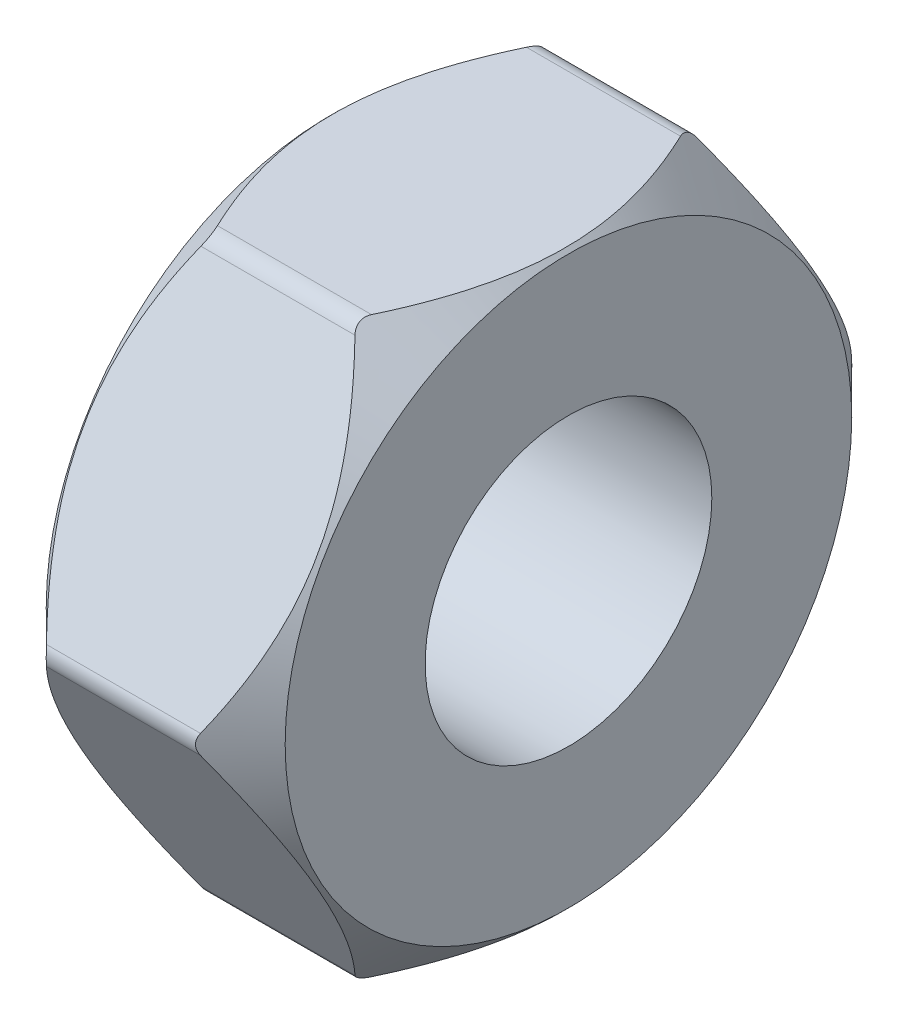
from build123d import *

# Parameters (mm, degrees)
ESQUISSE1_R                           = 15
BOSS_EXTRU_1_DEPTH                    = 25
CONG_1_R                              = 2
CHANFREIN1_SIZE                       = 2
ENL_VEMENT_DE_MATI_RE_BALAYAGE3_PITCH = 4


with BuildPart() as part:
    # Esquisse1 → Boss.-Extru.1 (new body)
    with BuildSketch(Plane(origin=(0, 0, 0), x_dir=(0, 0, -1), z_dir=(1, 0, 0))):
        Polygon((34.641016151, 0), (17.320508076, 30), (-17.320508076, 30), (-34.641016151, 0), (-17.320508076, -30), (17.320508076, -30), align=None)
        Circle(ESQUISSE1_R, mode=Mode.SUBTRACT)
    extrude(amount=BOSS_EXTRU_1_DEPTH)

    # Esquisse2 → Enlèvement de matière-Révolution2 (revolve, cut)
    with BuildSketch(Plane(origin=(0, 0, 0), x_dir=(1, 0, 0), z_dir=(0, 1, 0))):
        Polygon((0, -34.641016151), (0, -29.641016151), (5, -34.641016151), align=None)
        Polygon((25, -34.641016151), (25, -29.641016151), (20, -34.641016151), align=None)
    revolve(axis=Axis((-5.539786703, 0, 0), (1, 0, 0)), mode=Mode.SUBTRACT)

    # Congé1
    # the kernel refuses this fillet: 2 mm, written as the material it takes off along each edge
    with BuildSketch(Plane(origin=(2.113248654, 30, 17.320508076), x_dir=(0, 0, -1), z_dir=(1, 0, 0)), Plane(origin=(2.113248654, -30, 17.320508076), x_dir=(0, 0.8660254037844392, 0.49999999999999933), z_dir=(1, 0, 0)), Plane(origin=(2.113248654, 30, -17.320508076), x_dir=(0, -0.8660254037844392, -0.49999999999999933), z_dir=(1, 0, 0))) as cong_1_piece_1:
        with BuildLine():
            CenterArc((CONG_1_R * 0.57735026919, -CONG_1_R), CONG_1_R, 90, 60)
            Line((-CONG_1_R * 0.288675134595, -CONG_1_R * 0.5), (0, 0))
            Line((0, 0), (CONG_1_R * 0.57735026919, 0))
        make_face()
    extrude(amount=20.773502692, mode=Mode.SUBTRACT)
    with BuildSketch(Plane(origin=(2.113248654, 0, 34.641016151), x_dir=(0, -0.8660254037844395, -0.49999999999999856), z_dir=(1, 0, 0)), Plane(origin=(2.113248654, -30, -17.320508076), x_dir=(0, 0.8660254037844393, -0.49999999999999895), z_dir=(1, 0, 0)), Plane(origin=(2.113248654, 0, -34.641016151), x_dir=(0, 0.8660254037844395, 0.49999999999999856), z_dir=(1, 0, 0))) as cong_1_piece_2:
        with BuildLine():
            CenterArc((CONG_1_R * 0.57735026919, CONG_1_R), CONG_1_R, 210, 60)
            Line((-CONG_1_R * 0.288675134595, CONG_1_R * 0.5), (0, 0))
            Line((0, 0), (CONG_1_R * 0.57735026919, 0))
        make_face()
    extrude(amount=20.773502692, mode=Mode.SUBTRACT)

    # Chanfrein1
    chanfrein1_edges = [part.edges().sort_by_distance(p)[0] for p in [
        (0, 0, 15),
    ]]
    chamfer(chanfrein1_edges, length=CHANFREIN1_SIZE)

    # Enlèvement de matière-Balayage3: arcs per turn and ends read off the stored shape
    # Enlèvement de matière-Balayage3: the profile of Esquisse15 screwed along a right-hand helix through 0.755367 turns, 12 arcs to a turn; built about Z, then put on its axis
    enl_vement_de_mati_re_balayage3_z = Axis((0, 0, 0), (0, 0, 1))
    enl_vement_de_mati_re_balayage3_corners = [(17.470538667, -0.883333846, -1.521778837), (18.693034054, -3.175822674, -0.021778837), (18.693034054, -3.175822674, -3.021778837)]
    with BuildLine(mode=Mode.PRIVATE) as enl_vement_de_mati_re_balayage3_profile:
        Line(enl_vement_de_mati_re_balayage3_corners[0], enl_vement_de_mati_re_balayage3_corners[1])
        Line(enl_vement_de_mati_re_balayage3_corners[1], enl_vement_de_mati_re_balayage3_corners[2])
        Line(enl_vement_de_mati_re_balayage3_corners[2], enl_vement_de_mati_re_balayage3_corners[0])
    enl_vement_de_mati_re_balayage3_cap = Face(enl_vement_de_mati_re_balayage3_profile.wire())
    enl_vement_de_mati_re_balayage3_turn_angles = [0, 15, 30, 45, 60, 75, 90, 105, 120, 135, 150, 165, 180, 195, 210, 225, 240, 255, 270, 270.966, 271.932]
    enl_vement_de_mati_re_balayage3_turn_weights = [1, 0.9659258262890683, 1, 0.9659258262890683, 1, 0.9659258262890683, 1, 0.9659258262890683, 1, 0.9659258262890683, 1, 0.9659258262890683, 1, 0.9659258262890683, 1, 0.9659258262890683, 1, 0.9659258262890683, 1, 0.9998578755801968, 1]
    enl_vement_de_mati_re_balayage3_turn_rails = [Edge.make_bspline([Vector(p[0], p[1], 0).rotate(enl_vement_de_mati_re_balayage3_z, enl_vement_de_mati_re_balayage3_turn_angles[k]) / enl_vement_de_mati_re_balayage3_turn_weights[k] + Vector(0, 0, p[2] + ENL_VEMENT_DE_MATI_RE_BALAYAGE3_PITCH * enl_vement_de_mati_re_balayage3_turn_angles[k] / 360) for k in range(21)], [0, 0, 0, 1, 1, 2, 2, 3, 3, 4, 4, 5, 5, 6, 6, 7, 7, 8, 8, 9, 9, 10, 10, 10], 2, enl_vement_de_mati_re_balayage3_turn_weights) for p in enl_vement_de_mati_re_balayage3_corners]
    enl_vement_de_mati_re_balayage3_turn_sides = [Face.make_surface_from_curves(enl_vement_de_mati_re_balayage3_turn_rails[p[0]], enl_vement_de_mati_re_balayage3_turn_rails[p[1]]) for p in [(0, 1), (1, 2), (2, 0)]]
    enl_vement_de_mati_re_balayage3 = Plane(origin=(0, 0, 0), x_dir=(0, -0.8660254037844328, 0.5000000000000101), z_dir=(1, 0, 0)) * Solid(Shell([*enl_vement_de_mati_re_balayage3_turn_sides, enl_vement_de_mati_re_balayage3_cap, enl_vement_de_mati_re_balayage3_cap.rotate(enl_vement_de_mati_re_balayage3_z, 271.932).moved(Location((0, 0, ENL_VEMENT_DE_MATI_RE_BALAYAGE3_PITCH * 271.932 / 360)))]))
    add(enl_vement_de_mati_re_balayage3, mode=Mode.SUBTRACT)


solid = part.part
